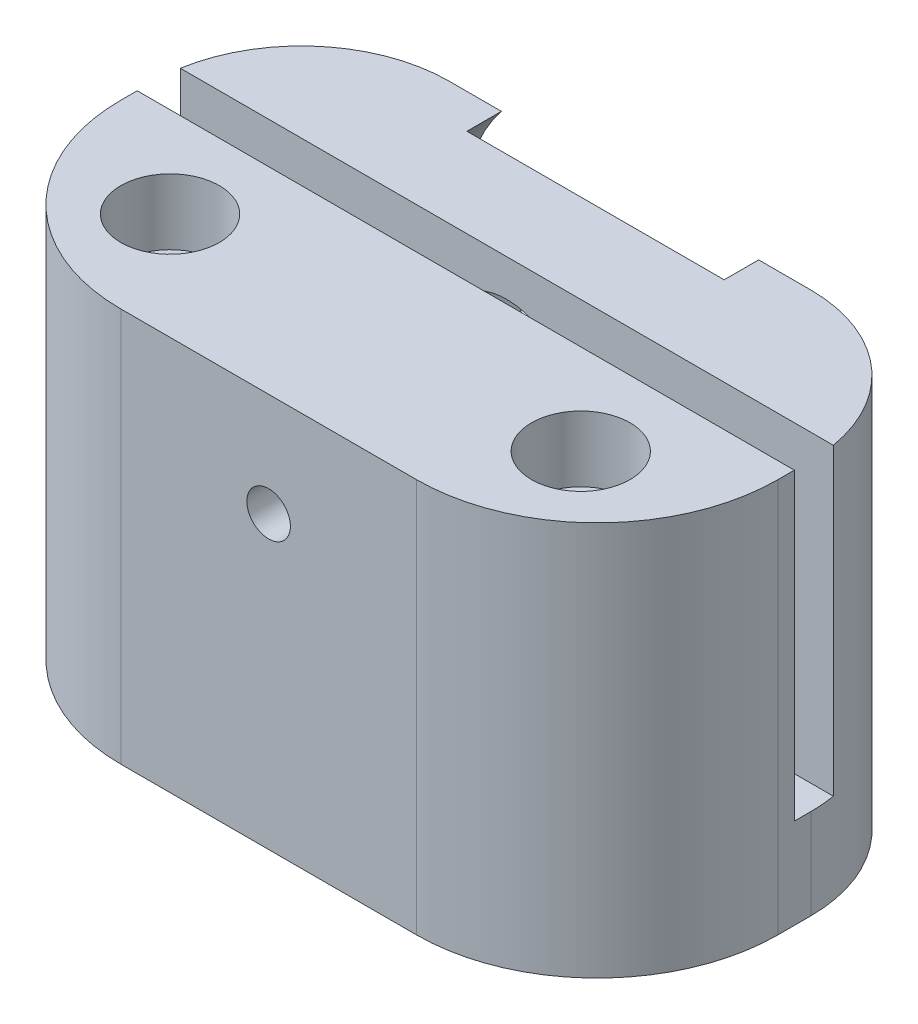
from build123d import *

# Parameters (mm, degrees)
SKETCH2_W                                          = 40
SKETCH2_H                                          = 12
BOSS_EXTRUDE1_DEPTH                                = 24
CBORE_FOR_M2_5_HEX_HEAD_MACHINE_SCREW1_D           = 3
CBORE_FOR_M2_5_HEX_HEAD_MACHINE_SCREW1_DEPTH       = 38.1
CBORE_FOR_M2_5_HEX_HEAD_MACHINE_SCREW1_CBORE_D     = 6
CBORE_FOR_M2_5_HEX_HEAD_MACHINE_SCREW1_CBORE_DEPTH = 4
CBORE_FOR_M2_5_HEX_HEAD_MACHINE_SCREW1_TIP         = 0.901290929
SKETCH11_W                                         = 40
SKETCH11_H                                         = 5.5
BOSS_EXTRUDE2_DEPTH                                = 10
SKETCH12_W                                         = 40
SKETCH12_H                                         = 7.5
BOSS_EXTRUDE3_DEPTH                                = 18.5
CUT_EXTRUDE1_DEPTH                                 = 17
CUT_EXTRUDE1_DEPTH_BACK                            = 6
SKETCH10_R                                         = 4.05
SKETCH13_R                                         = 4.8
CUT_EXTRUDE2_DEPTH                                 = 5.5
SKETCH14_R                                         = 10.05
CUT_EXTRUDE3_DEPTH                                 = 2.1
TAP_DRILL_FOR_M2_5_HELICOIL1_D                     = 2.65
FILLET1_R                                          = 11
FILLET2_R                                          = 9


with BuildPart() as part:
    # Sketch2 → Boss-Extrude1 (new body)
    with BuildSketch(Plane(origin=(0, 0, 0), x_dir=(1, 0, 0), z_dir=(0, 1, 0))):
        with Locations((20, 6)):
            Rectangle(SKETCH2_W, SKETCH2_H)
    extrude(amount=BOSS_EXTRUDE1_DEPTH)

    # CBORE for M2.5 Hex Head Machine Screw1
    with Locations(Plane(origin=(0, 24, 0), x_dir=(1, 0, 0), z_dir=(0, 1, 0))):
        with Locations((7.5, 6.5), (32.5, 6.5)):
            CounterBoreHole(CBORE_FOR_M2_5_HEX_HEAD_MACHINE_SCREW1_D / 2, CBORE_FOR_M2_5_HEX_HEAD_MACHINE_SCREW1_CBORE_D / 2, CBORE_FOR_M2_5_HEX_HEAD_MACHINE_SCREW1_CBORE_DEPTH, depth=CBORE_FOR_M2_5_HEX_HEAD_MACHINE_SCREW1_DEPTH)
            with Locations((0, 0, -(CBORE_FOR_M2_5_HEX_HEAD_MACHINE_SCREW1_DEPTH + CBORE_FOR_M2_5_HEX_HEAD_MACHINE_SCREW1_TIP / 2))):  # 118° drill point
                Cone(0, CBORE_FOR_M2_5_HEX_HEAD_MACHINE_SCREW1_D / 2, CBORE_FOR_M2_5_HEX_HEAD_MACHINE_SCREW1_TIP, mode=Mode.SUBTRACT)

    # Sketch11 → Boss-Extrude2 (add)
    with BuildSketch(Plane(origin=(0, 0, -12), x_dir=(-1, 0, 0), z_dir=(0, 0, -1))):
        with Locations((-20, 2.75)):
            Rectangle(SKETCH11_W, SKETCH11_H)
    extrude(amount=BOSS_EXTRUDE2_DEPTH)

    # Sketch12 → Boss-Extrude3 (add)
    with BuildSketch(Plane(origin=(0, 5.5, 0), x_dir=(1, 0, 0), z_dir=(0, 1, 0))):
        with Locations((20, 18.25)):
            Rectangle(SKETCH12_W, SKETCH12_H)
    extrude(amount=BOSS_EXTRUDE3_DEPTH)

    # Sketch10 → Cut-Extrude1 (cut, two sides: drawn at the far end of the back side and taken through both)
    with BuildSketch(Plane(origin=(0, 0, -12), x_dir=(-1, 0, 0), z_dir=(0, 0, -1)).offset(-CUT_EXTRUDE1_DEPTH_BACK)):
        with Locations((-20, 17.7)):
            Circle(SKETCH10_R)
    extrude(amount=CUT_EXTRUDE1_DEPTH + CUT_EXTRUDE1_DEPTH_BACK, mode=Mode.SUBTRACT)

    # Sketch13 → Cut-Extrude2 (cut)
    with BuildSketch(Plane(origin=(0, 0, -22), x_dir=(-1, 0, 0), z_dir=(0, 0, -1))):
        with Locations((-20, 17.7)):
            Circle(SKETCH13_R)
    extrude(amount=-CUT_EXTRUDE2_DEPTH, mode=Mode.SUBTRACT)

    # Sketch14 → Cut-Extrude3 (cut)
    with BuildSketch(Plane(origin=(0, 0, -22), x_dir=(-1, 0, 0), z_dir=(0, 0, -1))):
        with Locations((-20, 17.7)):
            Circle(SKETCH14_R)
    extrude(amount=-CUT_EXTRUDE3_DEPTH, mode=Mode.SUBTRACT)

    # Tap Drill for M2.5 Helicoil1 (through all)
    with Locations(Plane(origin=(0, 0, -6), x_dir=(-1, 0, 0), z_dir=(0, 0, -1))):
        with Locations((-20, 17.7)):
            Hole(TAP_DRILL_FOR_M2_5_HELICOIL1_D / 2)

    # Fillet1
    fillet1_edges = [part.edges().sort_by_distance(p)[0] for p in [
        (0, 12, 0),
        (40, 12, 0),
    ]]
    fillet(fillet1_edges, radius=FILLET1_R)

    # Fillet2
    fillet2_edges = [part.edges().sort_by_distance(p)[0] for p in [
        (0, 12, -22),
        (40, 12, -22),
    ]]
    fillet(fillet2_edges, radius=FILLET2_R)


solid = part.part
